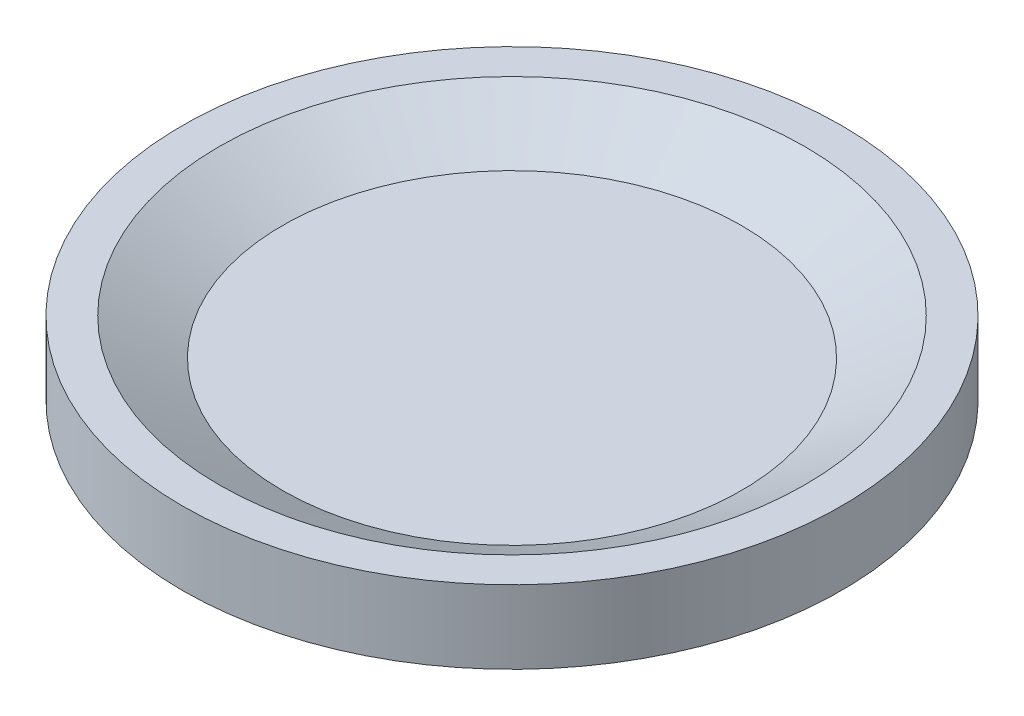
from build123d import *


with BuildPart() as part:
    # Sketch2 → Revolve1 (revolve)
    with BuildSketch(Plane(origin=(0, 0, 0), x_dir=(0, 0, -1), z_dir=(1, 0, 0))):
        Polygon((0, 0), (0, -1.5875), (-14.2875, -1.5875), (-14.2875, 0), (-14.2875, 1.5875), (-12.7, 1.5875), (-9.950369343, 0), align=None)
    revolve(axis=Axis((0, 0, 0), (0, 1, 0)))


solid = part.part
